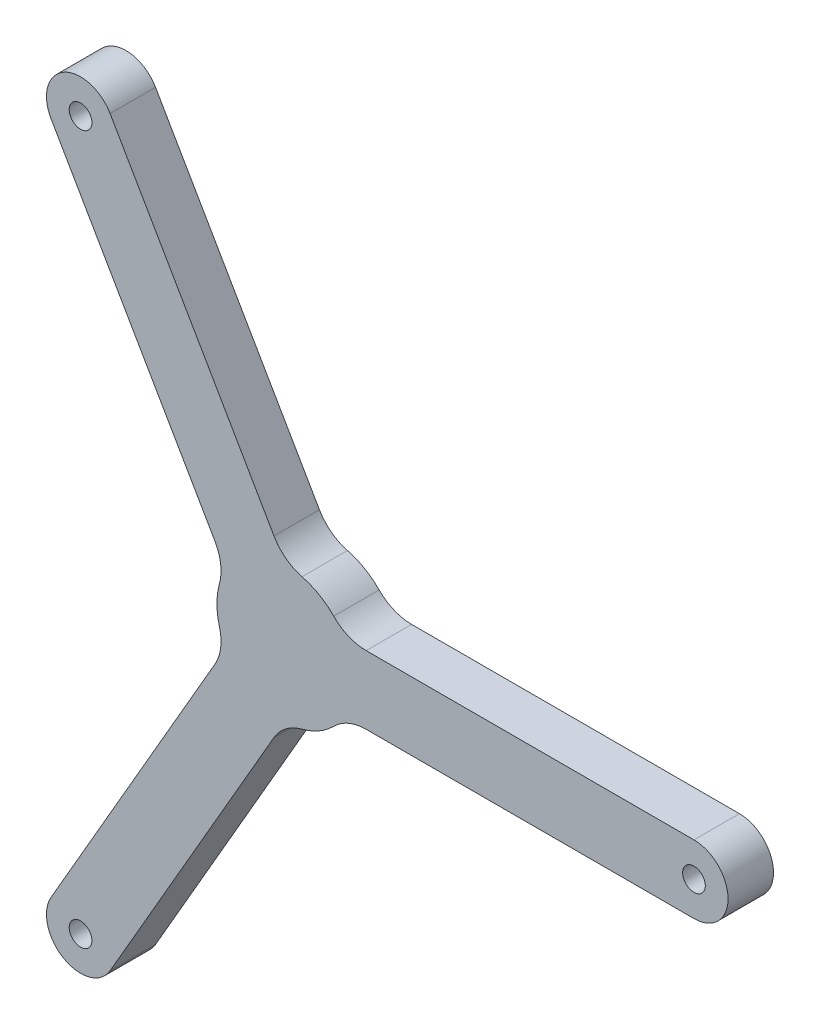
from build123d import *

# Parameters (mm, degrees)
SKETCH1_R                = 2.5
BOSS_EXTRUDE1_DEPTH      = 10
FILLET1_R                = 10
CIRPATTERN2_COUNT        = 3
FILLET1_OF_CIRPATTERN2_R = 10


with BuildPart() as part:
    # Sketch1 → Boss-Extrude1 (new body)
    with BuildSketch(Plane.XY):
        with BuildLine():
            Line((90, 7.5), (12.990381057, 7.5))
            ThreePointArc((12.990381057, 7.5), (-15, 0), (12.990381057, -7.5))
            Line((12.990381057, -7.5), (90, -7.5))
            ThreePointArc((90, -7.5), (97.5, 0), (90, 7.5))
        make_face()
        with Locations((90, 0)):
            Circle(SKETCH1_R, mode=Mode.SUBTRACT)
    boss_extrude1 = extrude(amount=BOSS_EXTRUDE1_DEPTH)

    # Fillet1
    fillet1_edges = [part.edges().sort_by_distance(p)[0] for p in [
        (12.990381057, 7.5, 5),
        (12.990381057, -7.5, 5),
    ]]
    fillet(fillet1_edges, radius=FILLET1_R)

    # CirPattern2: Boss-Extrude1 ×3 about axis
    cirpattern2_axis = Axis((0, 0, 10), (0, 0, -1))
    for i in range(1, CIRPATTERN2_COUNT):
        add(boss_extrude1.rotate(cirpattern2_axis, i * 360 / CIRPATTERN2_COUNT))

    # Fillet1 of CirPattern2
    fillet1_of_cirpattern2_edges = [part.edges().sort_by_distance(p)[0] for p in [
        (0, -15, 5),
        (-12.990381057, -7.5, 5),
        (-12.990381057, 7.5, 5),
        (0, 15, 5),
    ]]
    fillet(fillet1_of_cirpattern2_edges, radius=FILLET1_OF_CIRPATTERN2_R)


solid = part.part
